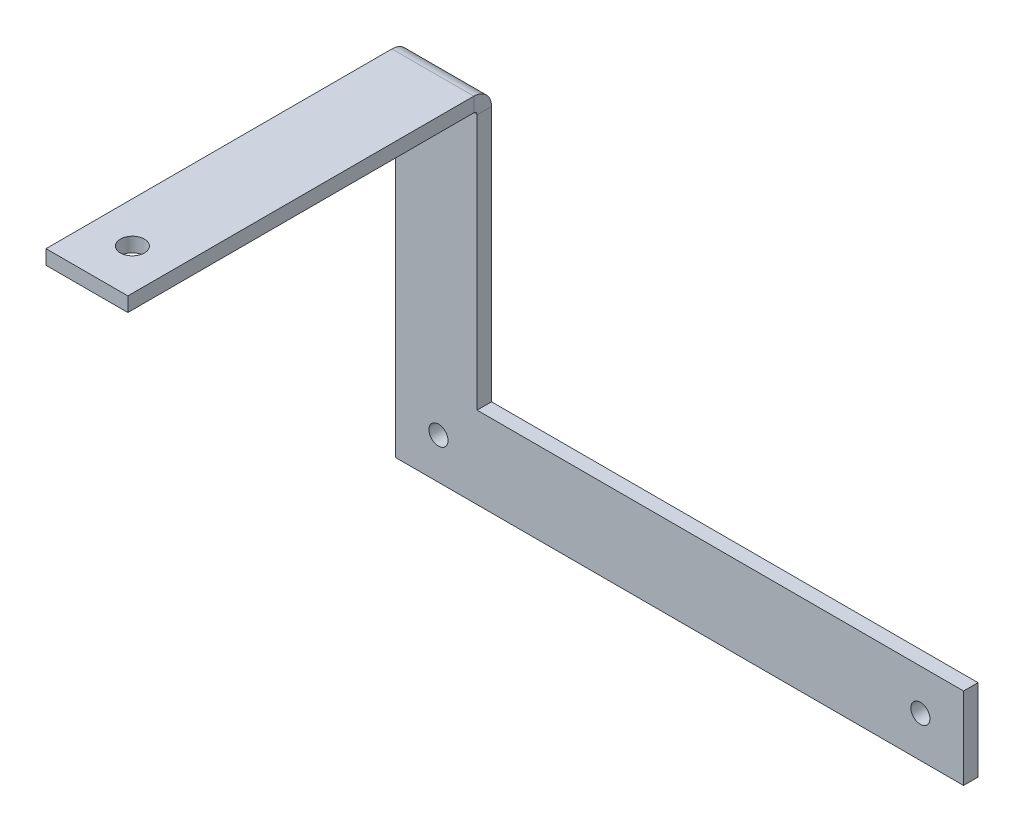
from build123d import *

# Parameters (mm, degrees)
BASE_FLANGE1_DEPTH           = 3.175
EDGE_FLANGE1_STRIP_W         = 14.1732
EDGE_FLANGE1_STRIP_H         = 3.175
EDGE_FLANGE1_STRIP_CUT_DEPTH = 18
EDGE_FLANGE1_DEPTH           = 18
M5X0_8_TAPPED_HOLE1_D        = 4.2
HOLE2_START                  = 75
HOLE2_OUTLINE_R              = 2.65
HOLE2_DEPTH                  = 3.175


# Read off the part's stored shape, not the designer's step: Hole2
# Sheet-metal steps are written as plain solids
with BuildPart() as part:
    # Sketch1 → Base-Flange1 (new body)
    with BuildSketch(Plane.XY):
        Polygon((0, 75), (0, 0), (125, 0), (125, 18), (18, 18), (18, 75), align=None)
    extrude(amount=-BASE_FLANGE1_DEPTH)

    # Edge-Flange1 strip (across the edge) → Edge-Flange1 strip cut (cut)
    with BuildSketch(Plane(origin=(18, 75, 0), x_dir=(0, -1, 0), z_dir=(-1, 0, 0))):
        with Locations((-6.35, -1.5875)):
            Rectangle(EDGE_FLANGE1_STRIP_W, EDGE_FLANGE1_STRIP_H)
    extrude(amount=EDGE_FLANGE1_STRIP_CUT_DEPTH, mode=Mode.SUBTRACT)

    # Edge-Flange1 section (across the edge) → Edge-Flange1 (add)
    with BuildSketch(Plane(origin=(18, 75, 0), x_dir=(0, -1, 0), z_dir=(-1, 0, 0))):
        with BuildLine():
            Line((-3.175, 0.7366), (-3.175, 76.825))
            Line((-3.175, 76.825), (0, 76.825))
            Line((0, 76.825), (0, 0.7366))
            ThreePointArc((0, 0.7366), (0.215745145, 0.215745145), (0.7366, 0))
            Line((0.7366, 0), (0.7366, -3.175))
            ThreePointArc((0.7366, -3.175), (-2.029318885, -2.029318885), (-3.175, 0.7366))
        make_face()
    extrude(amount=EDGE_FLANGE1_DEPTH)

    # M5x0.8 Tapped Hole1 (through all)
    with Locations(Plane.XY):
        with Locations((9.5, 9), (115.5, 9)):
            Hole(M5X0_8_TAPPED_HOLE1_D / 2)

    # Hole2 outline → Hole2 (cut)
    with BuildSketch(Plane(origin=(0, 0, 0), x_dir=(1, 0, 0), z_dir=(0, 1, 0)).offset(HOLE2_START)):
        with Locations((9, -66.825)):
            Circle(HOLE2_OUTLINE_R)
    extrude(amount=HOLE2_DEPTH, mode=Mode.SUBTRACT)


solid = part.part
